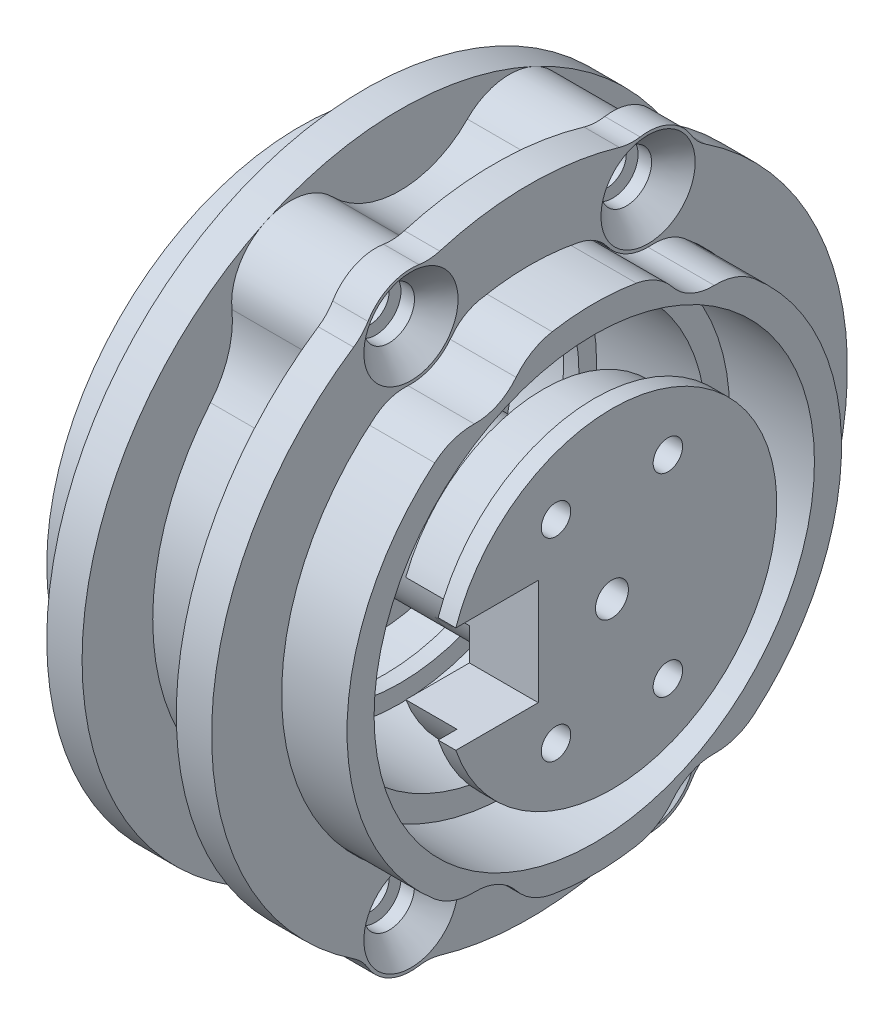
from build123d import *

# Parameters (mm, degrees)
SKETCH4_W                                      = 3
SKETCH4_H                                      = 5.95
CUT_EXTRUDE1_START                             = -6.794805001
CUT_EXTRUDE1_OUTLINE_W                         = 1.5
CUT_EXTRUDE1_OUTLINE_H                         = 4.325
CUT_EXTRUDE1_OUTLINE_H_2                       = 3.325
CUT_EXTRUDE1_DEPTH                             = 13.589610002
CUT_EXTRUDE2_START                             = 10.15
CUT_EXTRUDE2_DEPTH                             = 1.5
CUT_EXTRUDE2_START_2                           = -1.5
CUT_EXTRUDE2_2_DEPTH                           = 1.5
M3X0_5_START                                   = -14
M3X0_5_TAPPED_HOLE1_OUTLINE_R                  = 1.25
M3X0_5_TAPPED_HOLE1_DEPTH                      = 28
CUT_EXTRUDE3_DEPTH                             = 7.85
CUT_EXTRUDE4_DEPTH                             = 44.577517139
CUT_EXTRUDE4_DEPTH_BACK                        = 3.5
BOSS_EXTRUDE1_START                            = -3
BOSS_EXTRUDE1_DEPTH                            = 3
CSK_FOR_M4_FLAT_HEAD_MACHINE_SCREW3_AT_2_COUNT = 2
CSK_FOR_M4_FLAT_HEAD_MACHINE_SCREW3_AT_2_PITCH = 20.137760172
CSK_FOR_M4_FLAT_HEAD_MACHINE_SCREW3_AT_3_COUNT = 2
CSK_FOR_M4_FLAT_HEAD_MACHINE_SCREW3_AT_3_PITCH = 47.65
CSK_FOR_M4_FLAT_HEAD_MACHINE_SCREW3_AT_4_COUNT = 2
CSK_FOR_M4_FLAT_HEAD_MACHINE_SCREW3_AT_4_PITCH = 43.185566052
FILLET1_R                                      = 4
FILLET2_R                                      = 5
BOSS_EXTRUDE2_DEPTH                            = 7.5
SKETCH23_W                                     = 1.65
SKETCH23_H                                     = 17.5
M4X0_7_TAPPED_HOLE2_AT_2_COUNT                 = 2
M4X0_7_TAPPED_HOLE2_AT_2_PITCH                 = 20.137760172
M4X0_7_TAPPED_HOLE2_AT_3_COUNT                 = 2
M4X0_7_TAPPED_HOLE2_AT_3_PITCH                 = 47.65
M4X0_7_TAPPED_HOLE2_AT_4_COUNT                 = 2
M4X0_7_TAPPED_HOLE2_AT_4_PITCH                 = 43.185566052


# Read off the part's stored shape, not the designer's step: Cut-Extrude1, Cut-Extrude2, M3x0.5 Tapped Hole1, Cut-Extrude3
with BuildPart() as part:
    # Sketch3 → Revolve1 (revolve)
    with BuildSketch(Plane.XY, mode=Mode.PRIVATE) as revolve1_sk:
        Polygon((-8.5, 4), (-5.5, 4), (-5.5, 7.5), (-6, 7.5), (-6, 12.5), (-12.5, 12.5), (-12.5, 14), (-14, 14), (-14, 6.5), (-8.5, 6.5), align=None)
        Polygon((8.15, 12.5), (12.5, 12.5), (12.5, 14), (14, 14), (14, 1.4), (7.5, 1.4), (7.5, 4), (4.65, 4), (4.65, 6.5), (8.15, 6.5), align=None)
        Polygon((5.3, 18.7), (12.5, 18.7), (12.5, 21), (-4, 21), (-4, 27), (-7, 27), (-7, 21.5), (-12.5, 21.5), (-12.5, 18.7), (-5.3, 18.7), (-5.3, 15.2), (-4, 15.2), (-4, 16.7), (5.3, 16.7), align=None)
    revolve(revolve1_sk.sketch.rotate(Axis((-22.070953437, 0, 0), (1, 0, 0)), 90), axis=Axis((-22.070953437, 0, 0), (1, 0, 0)))

    # Cut-Extrude2 outline → Cut-Extrude2 (cut)
    with BuildSketch(Plane(origin=(-5.5, 0, 0), x_dir=(0, 0, -1), z_dir=(1, 0, 0)).offset(CUT_EXTRUDE2_START)):
        with BuildLine():
            Line((2.432976572, -3.175), (5.671805268, -3.175))
            ThreePointArc((5.671805268, -3.175), (6.5, 0), (5.671805268, 3.175))
            Line((5.671805268, 3.175), (2.432976572, 3.175))
            ThreePointArc((2.432976572, 3.175), (4, 0), (2.432976572, -3.175))
        make_face()
        with BuildLine():
            ThreePointArc((-5.671805268, 3.175), (-6.5, 0), (-5.671805268, -3.175))
            Line((-5.671805268, -3.175), (-2.432976572, -3.175))
            ThreePointArc((-2.432976572, -3.175), (-4, 0), (-2.432976572, 3.175))
            Line((-2.432976572, 3.175), (-5.671805268, 3.175))
        make_face()
    extrude(amount=CUT_EXTRUDE2_DEPTH, mode=Mode.SUBTRACT)

    # Cut-Extrude2 2 outline → Cut-Extrude2 2 (cut)
    with BuildSketch(Plane(origin=(-5.5, 0, 0), x_dir=(0, 0, -1), z_dir=(1, 0, 0)).offset(CUT_EXTRUDE2_START_2)):
        with BuildLine():
            ThreePointArc((-12.090052729, 3.175), (-12.5, 0), (-12.090052729, -3.175))
            Line((-12.090052729, -3.175), (-2.432976572, -3.175))
            ThreePointArc((-2.432976572, -3.175), (-4, 0), (-2.432976572, 3.175))
            Line((-2.432976572, 3.175), (-12.090052729, 3.175))
        make_face()
        with BuildLine():
            Line((12.090052729, 3.175), (2.432976572, 3.175))
            ThreePointArc((2.432976572, 3.175), (4, 0), (2.432976572, -3.175))
            Line((2.432976572, -3.175), (12.090052729, -3.175))
            ThreePointArc((12.090052729, -3.175), (12.5, 0), (12.090052729, 3.175))
        make_face()
    extrude(amount=CUT_EXTRUDE2_2_DEPTH, mode=Mode.SUBTRACT)

    # M3x0.5 Tapped Hole1 outline → M3x0.5 Tapped Hole1 (cut)
    with BuildSketch(Plane.YZ.offset(M3X0_5_START)):
        with Locations((8.227241336, 4.75)):
            Circle(M3X0_5_TAPPED_HOLE1_OUTLINE_R)
        with Locations((8.227241336, -4.75)):
            Circle(M3X0_5_TAPPED_HOLE1_OUTLINE_R)
        with Locations((-8.227241336, -4.75)):
            Circle(M3X0_5_TAPPED_HOLE1_OUTLINE_R)
        with Locations((-8.227241336, 4.75)):
            Circle(M3X0_5_TAPPED_HOLE1_OUTLINE_R)
    extrude(amount=M3X0_5_TAPPED_HOLE1_DEPTH, mode=Mode.SUBTRACT)

    # Cut-Extrude3 outline → Cut-Extrude3 (cut)
    with BuildSketch(Plane.ZY.offset(-14)):
        with BuildLine():
            Line((6.257073584, 4.5), (6.257073584, -4.5))
            Line((6.257073584, -4.5), (13.257073584, -4.5))
            ThreePointArc((13.257073584, -4.5), (14, 0), (13.257073584, 4.5))
            Line((13.257073584, 4.5), (6.257073584, 4.5))
        make_face()
    extrude(amount=CUT_EXTRUDE3_DEPTH, mode=Mode.SUBTRACT)

    # Sketch11 → Cut-Extrude4 (cut, two sides: drawn at the far end of the back side and taken through both)
    with BuildSketch(Plane(origin=(7, 0, 0), x_dir=(0, 0, -1), z_dir=(1, 0, 0)).offset(-CUT_EXTRUDE4_DEPTH_BACK)):
        with BuildLine():
            ThreePointArc((-11.610569962, 17.498418933), (-8.219925191, 17.627686458), (-5.941436074, 20.14197948))
            ThreePointArc((-5.941436074, 20.14197948), (-8.874983497, 19.032463528), (-11.610569962, 17.498418933))
        make_face()
        with BuildLine():
            ThreePointArc((11.610569962, 17.498418933), (8.219925191, 17.627686458), (5.941436074, 20.14197948))
            ThreePointArc((5.941436074, 20.14197948), (8.874983497, 19.032463528), (11.610569962, 17.498418933))
        make_face()
        with BuildLine():
            ThreePointArc((-11.610569962, -17.498418933), (-8.219925191, -17.627686458), (-5.941436074, -20.14197948))
            ThreePointArc((-5.941436074, -20.14197948), (-8.874983497, -19.032463528), (-11.610569962, -17.498418933))
        make_face()
        with BuildLine():
            ThreePointArc((11.610569962, -17.498418933), (8.219925191, -17.627686458), (5.941436074, -20.14197948))
            ThreePointArc((5.941436074, -20.14197948), (8.874983497, -19.032463528), (11.610569962, -17.498418933))
        make_face()
    extrude(amount=CUT_EXTRUDE4_DEPTH + CUT_EXTRUDE4_DEPTH_BACK, mode=Mode.SUBTRACT)

    # Fillet2
    fillet2_edges = [part.edges().sort_by_distance(p)[0] for p in [
        (8, 20.14197948, -5.941436074),
        (8, 17.498418933, -11.610569962),
        (8, -20.14197948, 5.941436074),
        (8, -17.498418933, 11.610569962),
        (8, -17.498418933, -11.610569962),
        (8, -20.14197948, -5.941436074),
        (8, 17.498418933, 11.610569962),
        (8, 20.14197948, 5.941436074),
    ]]
    fillet(fillet2_edges, radius=FILLET2_R)

    # Sketch21 → Boss-Extrude2 (add)
    with BuildSketch(Plane(origin=(-4, 0, 0), x_dir=(0, 0, -1), z_dir=(1, 0, 0))):
        with BuildLine():
            ThreePointArc((-14.271900696, 19.432461059), (-11.416711799, 24.4674988), (-5.721601082, 23.433369885))
            ThreePointArc((-5.721601082, 23.433369885), (0, 21.024727596), (5.721601082, 23.433369885))
            ThreePointArc((5.721601082, 23.433369885), (11.416711799, 24.4674988), (14.271900696, 19.432461059))
            ThreePointArc((14.271900696, 19.432461059), (14.583214812, 16.274011605), (16.098150308, 13.485160609))
            ThreePointArc((16.098150308, 13.485160609), (0, 21), (-16.098150308, 13.485160609))
            ThreePointArc((-16.098150308, 13.485160609), (-14.583214812, 16.274011605), (-14.271900696, 19.432461059))
        make_face()
        with BuildLine():
            ThreePointArc((-16.098150308, -13.485160609), (0, -21), (16.098150308, -13.485160609))
            ThreePointArc((16.098150308, -13.485160609), (14.583214812, -16.274011605), (14.271900696, -19.432461059))
            ThreePointArc((14.271900696, -19.432461059), (11.416711799, -24.4674988), (5.721601082, -23.433369885))
            ThreePointArc((5.721601082, -23.433369885), (0, -21.024727596), (-5.721601082, -23.433369885))
            ThreePointArc((-5.721601082, -23.433369885), (-11.416711799, -24.4674988), (-14.271900696, -19.432461059))
            ThreePointArc((-14.271900696, -19.432461059), (-14.583214812, -16.274011605), (-16.098150308, -13.485160609))
        make_face()
    extrude(amount=BOSS_EXTRUDE2_DEPTH)

    # Sketch23 → M4x0.7 Tapped Hole2 (revolve, cut)
    with BuildSketch(Plane(origin=(3.5, 21.592783026, 10.068880086), x_dir=(0, 0, -1), z_dir=(0, 1, 0))):
        with Locations((0.825, 8.75)):
            Rectangle(SKETCH23_W, SKETCH23_H)
    m4x0_7_tapped_hole2 = revolve(axis=Axis((9.85, 21.592783026, 10.068880086), (-1, 0, 0)), mode=Mode.SUBTRACT)

    # M4x0.7 Tapped Hole2 at 2: M4x0.7 Tapped Hole2 ×2
    with Locations(*[(0, 0, -i * M4X0_7_TAPPED_HOLE2_AT_2_PITCH) for i in range(1, M4X0_7_TAPPED_HOLE2_AT_2_COUNT)]):
        add(m4x0_7_tapped_hole2, mode=Mode.SUBTRACT)

    # M4x0.7 Tapped Hole2 at 3: M4x0.7 Tapped Hole2 ×2
    with Locations(*[Vector(0, -0.9063077870366494, -0.4226182617407008) * (i * M4X0_7_TAPPED_HOLE2_AT_3_PITCH) for i in range(1, M4X0_7_TAPPED_HOLE2_AT_3_COUNT)]):
        add(m4x0_7_tapped_hole2, mode=Mode.SUBTRACT)

    # M4x0.7 Tapped Hole2 at 4: M4x0.7 Tapped Hole2 ×2
    with Locations(*[(0, -i * M4X0_7_TAPPED_HOLE2_AT_4_PITCH, 0) for i in range(1, M4X0_7_TAPPED_HOLE2_AT_4_COUNT)]):
        add(m4x0_7_tapped_hole2, mode=Mode.SUBTRACT)


with BuildPart() as body_2:
    # Sketch4 → Revolve2 (revolve)
    with BuildSketch(Plane.XY, mode=Mode.PRIVATE) as revolve2_sk:
        Polygon((-4.15, 6.5), (-4.15, 7.5), (-7, 7.5), (-7, 4), (6.15, 4), (6.15, 6.5), align=None)
        with Locations((5.5, 24.025)):
            Rectangle(SKETCH4_W, SKETCH4_H)
    revolve(revolve2_sk.sketch.rotate(Axis((-22.070953437, 0, 0), (1, 0, 0)), 90), axis=Axis((-22.070953437, 0, 0), (1, 0, 0)))

    # Cut-Extrude1 outline → Cut-Extrude1 (cut)
    with BuildSketch(Plane.XY.offset(CUT_EXTRUDE1_START)):
        with Locations((-6.25, -5.3375)):
            Rectangle(CUT_EXTRUDE1_OUTLINE_W, CUT_EXTRUDE1_OUTLINE_H)
        with Locations((-6.25, 5.3375)):
            Rectangle(CUT_EXTRUDE1_OUTLINE_W, CUT_EXTRUDE1_OUTLINE_H)
        with Locations((5.4, 4.8375)):
            Rectangle(CUT_EXTRUDE1_OUTLINE_W, CUT_EXTRUDE1_OUTLINE_H_2)
        with Locations((5.4, -4.8375)):
            Rectangle(CUT_EXTRUDE1_OUTLINE_W, CUT_EXTRUDE1_OUTLINE_H_2)
    extrude(amount=CUT_EXTRUDE1_DEPTH, mode=Mode.SUBTRACT)

    # Sketch19 → Boss-Extrude1 (add)
    with BuildSketch(Plane(origin=(7, 0, 0), x_dir=(0, 0, -1), z_dir=(1, 0, 0)).offset(BOSS_EXTRUDE1_START)):
        with BuildLine():
            ThreePointArc((-11.539355124, 17.605277144), (-8.272752474, 17.740974931), (-6.069070228, 20.156112883))
            ThreePointArc((-6.069070228, 20.156112883), (-8.89611441, 19.077778917), (-11.539355124, 17.605277144))
        make_face()
        with BuildLine():
            ThreePointArc((11.539355124, 17.605277144), (8.272752474, 17.740974931), (6.069070228, 20.156112883))
            ThreePointArc((6.069070228, 20.156112883), (8.89611441, 19.077778917), (11.539355124, 17.605277144))
        make_face()
        with BuildLine():
            ThreePointArc((-11.539355124, -17.605277144), (-8.272752474, -17.740974931), (-6.069070228, -20.156112883))
            ThreePointArc((-6.069070228, -20.156112883), (-8.89611441, -19.077778917), (-11.539355124, -17.605277144))
        make_face()
        with BuildLine():
            ThreePointArc((11.539355124, -17.605277144), (8.272752474, -17.740974931), (6.069070228, -20.156112883))
            ThreePointArc((6.069070228, -20.156112883), (8.89611441, -19.077778917), (11.539355124, -17.605277144))
        make_face()
        with BuildLine():
            ThreePointArc((-14.061466585, 23.049406879), (-11.865007698, 25.444591121), (-8.618333562, 25.587581492))
            ThreePointArc((-8.618333562, 25.587581492), (-11.410693067, 24.47031025), (-14.061466585, 23.049406879))
        make_face()
        with BuildLine():
            ThreePointArc((14.061466585, 23.049406879), (11.865007698, 25.444591121), (8.618333562, 25.587581492))
            ThreePointArc((8.618333562, 25.587581492), (11.410693067, 24.47031025), (14.061466585, 23.049406879))
        make_face()
        with BuildLine():
            ThreePointArc((-14.061466585, -23.049406879), (-11.865007698, -25.444591121), (-8.618333562, -25.587581492))
            ThreePointArc((-8.618333562, -25.587581492), (-11.410693067, -24.47031025), (-14.061466585, -23.049406879))
        make_face()
        with BuildLine():
            ThreePointArc((14.061466585, -23.049406879), (11.865007698, -25.444591121), (8.618333562, -25.587581492))
            ThreePointArc((8.618333562, -25.587581492), (11.410693067, -24.47031025), (14.061466585, -23.049406879))
        make_face()
    extrude(amount=BOSS_EXTRUDE1_DEPTH)

    # Sketch20 → CSK for M4 Flat Head Machine Screw3 (revolve, cut)
    with BuildSketch(Plane(origin=(7, 21.592783026, 10.068880086), x_dir=(0, 0, -1), z_dir=(0, 1, 0))):
        Polygon((0, 0), (0, 21), (2.15, 21), (2.15, 1.85), (4, 0), align=None)
    csk_for_m4_flat_head_machine_screw3 = revolve(axis=Axis((13.35, 21.592783026, 10.068880086), (-1, 0, 0)), mode=Mode.SUBTRACT)

    # CSK for M4 Flat Head Machine Screw3 at 2: CSK for M4 Flat Head Machine Screw3 ×2
    with Locations(*[(0, 0, -i * CSK_FOR_M4_FLAT_HEAD_MACHINE_SCREW3_AT_2_PITCH) for i in range(1, CSK_FOR_M4_FLAT_HEAD_MACHINE_SCREW3_AT_2_COUNT)]):
        add(csk_for_m4_flat_head_machine_screw3, mode=Mode.SUBTRACT)

    # CSK for M4 Flat Head Machine Screw3 at 3: CSK for M4 Flat Head Machine Screw3 ×2
    with Locations(*[Vector(0, -0.9063077870366494, -0.4226182617407008) * (i * CSK_FOR_M4_FLAT_HEAD_MACHINE_SCREW3_AT_3_PITCH) for i in range(1, CSK_FOR_M4_FLAT_HEAD_MACHINE_SCREW3_AT_3_COUNT)]):
        add(csk_for_m4_flat_head_machine_screw3, mode=Mode.SUBTRACT)

    # CSK for M4 Flat Head Machine Screw3 at 4: CSK for M4 Flat Head Machine Screw3 ×2
    with Locations(*[(0, -i * CSK_FOR_M4_FLAT_HEAD_MACHINE_SCREW3_AT_4_PITCH, 0) for i in range(1, CSK_FOR_M4_FLAT_HEAD_MACHINE_SCREW3_AT_4_COUNT)]):
        add(csk_for_m4_flat_head_machine_screw3, mode=Mode.SUBTRACT)

    # Fillet1
    fillet1_edges = [body_2.edges().sort_by_distance(p)[0] for p in [
        (5.5, 17.605277144, 11.539355124),
        (5.5, 20.156112883, 6.069070228),
        (5.5, 20.156112883, -6.069070228),
        (5.5, 17.605277144, -11.539355124),
        (5.5, 25.587581492, 8.618333562),
        (5.5, 23.049406879, 14.061466585),
        (5.5, -17.605277144, -11.539355124),
        (5.5, -20.156112883, -6.069070228),
        (5.5, -20.156112883, 6.069070228),
        (5.5, -17.605277144, 11.539355124),
        (5.5, 23.049406879, -14.061466585),
        (5.5, 25.587581492, -8.618333562),
        (5.5, -23.049406879, 14.061466585),
        (5.5, -25.587581492, 8.618333562),
        (5.5, -25.587581492, -8.618333562),
        (5.5, -23.049406879, -14.061466585),
    ]]
    fillet(fillet1_edges, radius=FILLET1_R)


with BuildPart() as body_3:
    # Sketch24 → Revolve3 (revolve)
    with BuildSketch(Plane.XY, mode=Mode.PRIVATE) as revolve3_sk:
        Polygon((-14, 6.407456386), (-8.5, 6.407456386), (-8.5, 4), (7, 4), (7, 1.65), (-14, 1.65), align=None)
    revolve(revolve3_sk.sketch.rotate(Axis((-22.070953437, 0, 0), (1, 0, 0)), 90), axis=Axis((-22.070953437, 0, 0), (1, 0, 0)))

    # Sketch26 → CSK for M3 Flat Head Machine Screw1 (revolve, cut)
    with BuildSketch(Plane(origin=(-14, 0, 0), x_dir=(0, 0, 1), z_dir=(0, 1, 0))):
        Polygon((0, 0), (0, 28), (1.7, 28), (1.7, 1.45), (3.15, 0), align=None)
    revolve(axis=Axis((-20.35, 0, 0), (1, 0, 0)), mode=Mode.SUBTRACT)


solid = Compound([part.part, body_2.part, body_3.part])
